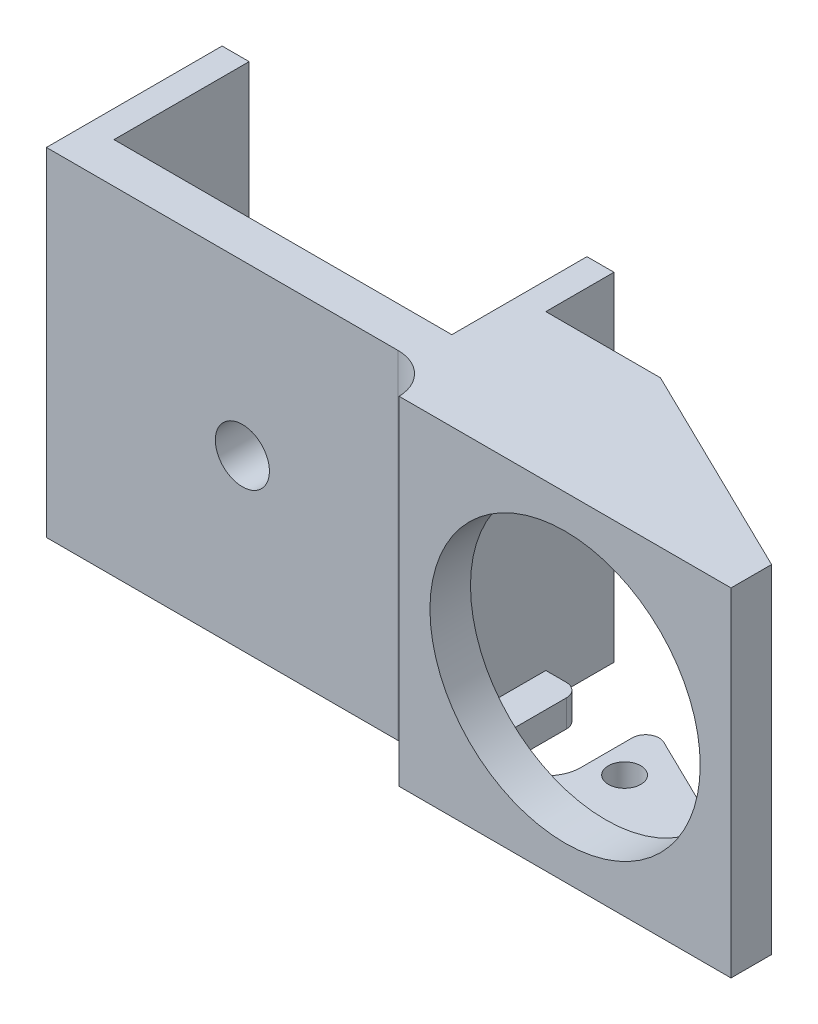
from build123d import *

# Parameters (mm, degrees)
SKETCH_1_W          = 24.561403508
SKETCH_1_H          = 25
SKETCH_1_R          = 10
EXTRUDE_1_DEPTH     = 3
EXTRUDE_START       = -2.9
SKETCH_2_W          = 29
SKETCH_2_H          = 25
EXTRUDE_2_DEPTH     = 3
SKETCH_4_W          = 2
SKETCH_4_H          = 25
EXTRUDE_3_DEPTH     = 10
EXTRUDE_4_DEPTH     = 2
SKETCH_6_R          = 1.2
EXTRUDE_5_DEPTH     = 2
SKETCH_7_R          = 2
CUT_EXTRUDE_1_DEPTH = 45.275798551
FILLET_1_R          = 3


with BuildPart() as part:
    # Эскиз1 → Бобышка-Вытянуть1 (new body)
    with BuildSketch(Plane.XY):
        Rectangle(SKETCH_1_W, SKETCH_1_H)
        Circle(SKETCH_1_R, mode=Mode.SUBTRACT)
    extrude(amount=EXTRUDE_1_DEPTH)

    # Эскиз2 → Бобышка-Вытянуть2 (add)
    with BuildSketch(Plane.XY.offset(3).offset(EXTRUDE_START)):
        with Locations((-26.780701754, 0)):
            Rectangle(SKETCH_2_W, SKETCH_2_H)
    extrude(amount=-EXTRUDE_2_DEPTH)

    # Эскиз4 → Бобышка-Вытянуть3 (add)
    with BuildSketch(Plane(origin=(0, 0, -2.9), x_dir=(-1, 0, 0), z_dir=(0, 0, -1))):
        with Locations((13.280701754, 0)):
            Rectangle(SKETCH_4_W, SKETCH_4_H)
        with Locations((40.280701754, 0)):
            Rectangle(SKETCH_4_W, SKETCH_4_H)
    extrude(amount=EXTRUDE_3_DEPTH)

    # Эскиз5 → Бобышка-Вытянуть4 (add)
    with BuildSketch(Plane(origin=(0, 12.5, 0), x_dir=(1, 0, 0), z_dir=(0, 1, 0))):
        Polygon((-14.280701754, 7.855101529), (-14.280701754, -0.1), (-12.280701754, -0.1), (-12.280701754, -3), (12.280701754, -3), (12.280701754, 0), (-3.796991433, 7.855101529), align=None)
    extrude(amount=-EXTRUDE_4_DEPTH)

    # Эскиз6 → Бобышка-Вытянуть5 (add)
    with BuildSketch(Plane.XZ.offset(12.5)):
        with BuildLine():
            Line((-12.280701754, 0), (-12.280701754, -7.855101529))
            Line((-12.280701754, -7.855101529), (-10.765310979, -7.855101529))
            ThreePointArc((-10.765310979, -7.855101529), (-10.058204198, -7.56220831), (-9.765310979, -6.855101529))
            Line((-9.765310979, -6.855101529), (-9.765310979, -2.916331119))
            ThreePointArc((-9.765310979, -2.916331119), (-7.265310979, -0.416331119), (-4.765310979, -2.916331119))
            Line((-4.765310979, -2.916331119), (-4.765310979, -6.726653445))
            ThreePointArc((-4.765310979, -6.726653445), (-4.294942972, -7.574880981), (-3.326331075, -7.625150325))
            Line((-3.326331075, -7.625150325), (12.280701754, 0))
            Line((12.280701754, 0), (-12.280701754, 0))
        make_face()
        with Locations(Location((-2.663311188, -4.066950409, 0), (0, 0, 270))):
            Circle(SKETCH_6_R, mode=Mode.SUBTRACT)
    extrude(amount=-EXTRUDE_5_DEPTH)

    # Эскиз7 → Вырез-Вытянуть1 (cut, through all)
    with BuildSketch(Plane(origin=(0, 0, -2.9), x_dir=(-1, 0, 0), z_dir=(0, 0, -1))):
        with Locations((26.780701754, 0)):
            Circle(SKETCH_7_R)
    extrude(amount=-CUT_EXTRUDE_1_DEPTH, mode=Mode.SUBTRACT)

    # Скругление1
    # the kernel refuses this fillet: 3 mm, written as the material it adds along each edge
    with BuildSketch(Plane(origin=(-12.280701754, -12.5, 0.1), x_dir=(0, 0, 1), z_dir=(0, 1, 0))) as fillet_1_piece_1:
        with BuildLine():
            CenterArc((3, -2.99833287), FILLET_1_R, 91.910213172, 88.089786828)
            Line((0, -2.99833287), (-0.06, -2.99833287))
            Line((-0.06, -2.99833287), (-0.06, 0))
            Line((-0.06, 0), (0, 0.06))
            ThreePointArc((0, 0.06), (1.45, 0.06), (2.898, 0.059966657))
            Line((2.898, 0.059966657), (2.9, 0))
        make_face()
    extrude(amount=25)


solid = part.part
